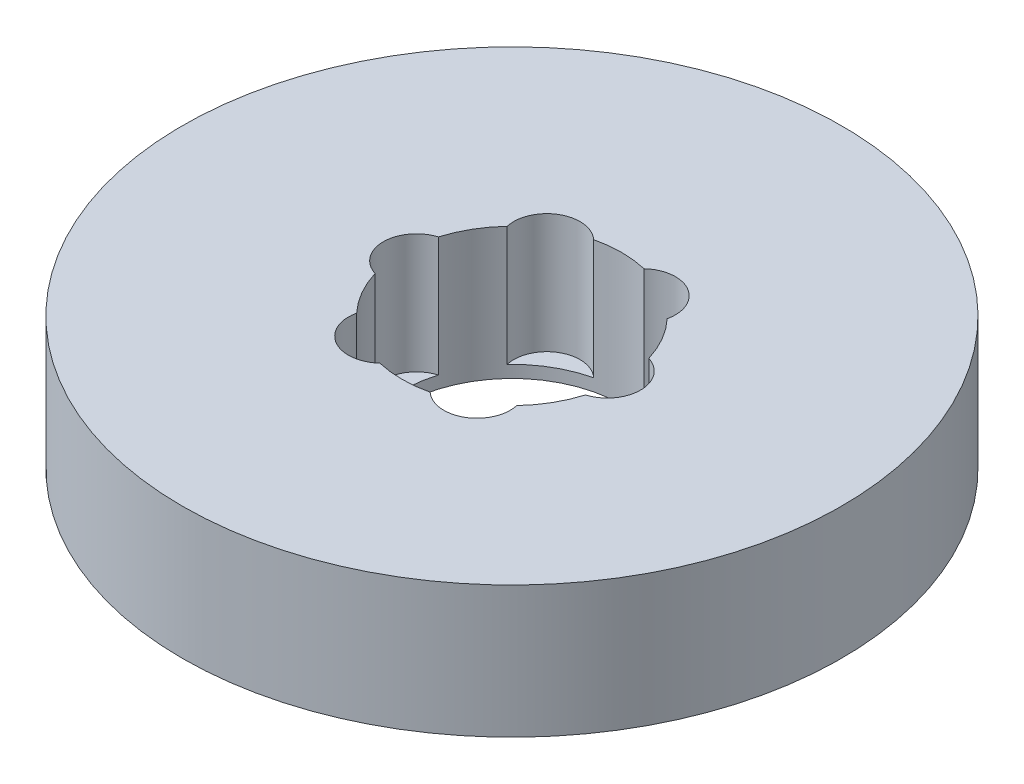
from build123d import *

# Parameters (mm, degrees)
SKETCH1_R           = 45
BOSS_EXTRUDE1_DEPTH = 18
SKETCH2_R           = 15
CUT_EXTRUDE1_DEPTH  = 67.136223055
SKETCH3_R           = 4.526260275
CUT_EXTRUDE2_DEPTH  = 16.327001944
CIRPATTERN1_COUNT   = 6


with BuildPart() as part:
    # Sketch1 → Boss-Extrude1 (new body)
    with BuildSketch(Plane(origin=(0, 0, 0), x_dir=(1, 0, 0), z_dir=(0, 1, 0))):
        Circle(SKETCH1_R)
    extrude(amount=BOSS_EXTRUDE1_DEPTH)

    # Sketch2 → Cut-Extrude1 (cut, through all)
    with BuildSketch(Plane(origin=(0, 0, 0), x_dir=(1, 0, 0), z_dir=(0, 1, 0))):
        Circle(SKETCH2_R)
    extrude(amount=CUT_EXTRUDE1_DEPTH, mode=Mode.SUBTRACT)

    # Sketch3 → Cut-Extrude2 (cut)
    with BuildSketch(Plane(origin=(0, 18, 0), x_dir=(1, 0, 0), z_dir=(0, 1, 0))):
        with Locations((-13.030483377, 0)):
            Circle(SKETCH3_R)
    cut_extrude2 = extrude(amount=-CUT_EXTRUDE2_DEPTH, mode=Mode.SUBTRACT)

    # CirPattern1: Cut-Extrude2 ×6 about axis
    cirpattern1_axis = Axis((0, 0, 0), (0, 1, 0))
    for i in range(1, CIRPATTERN1_COUNT):
        add(cut_extrude2.rotate(cirpattern1_axis, i * 360 / CIRPATTERN1_COUNT), mode=Mode.SUBTRACT)


solid = part.part
